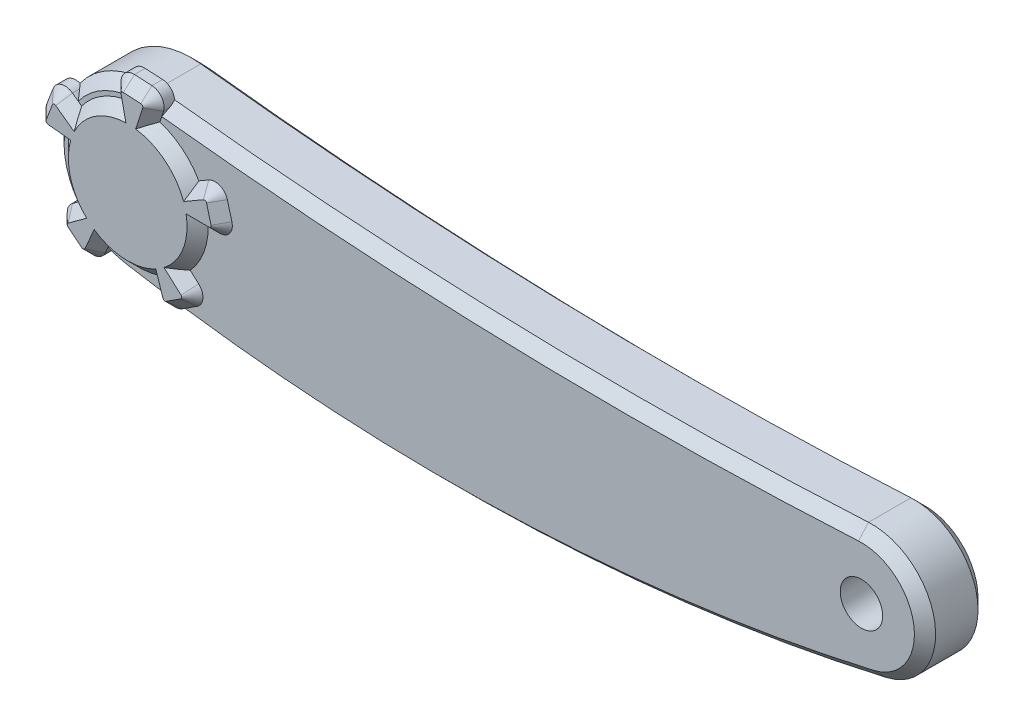
from build123d import *

# Parameters (mm, degrees)
BOSS_EXTRUDE2_DEPTH = 7.5
CHAMFER1_SIZE       = 2.5
SKETCH4_R           = 16.5
BOSS_EXTRUDE3_DEPTH = 2.5
BOSS_EXTRUDE4_DEPTH = 5
CHAMFER2_SIZE       = 2.5
SKETCH6_R           = 5
CUT_EXTRUDE1_DEPTH  = 10
SKETCH7_R           = 5
BOSS_EXTRUDE5_DEPTH = 10


with BuildPart() as part:
    # Sketch1 → Boss-Extrude2 (new, symmetric)
    with BuildSketch(Plane.XY):
        with BuildLine():
            ThreePointArc((84.460518945, 14.977598104), (0.616073919, 13.910903957), (-83.022979725, 19.872238008))
            ThreePointArc((-83.022979725, 19.872238008), (-105.080474764, 2.818038301), (-88.656802688, -19.712869593))
            ThreePointArc((-88.656802688, -19.712869593), (0.254242747, -25.987416271), (88.657894096, -14.614713664))
            ThreePointArc((88.657894096, -14.614713664), (100.131353297, 2.106516275), (84.460518945, 14.977598104))
        make_face()
    extrude(amount=BOSS_EXTRUDE2_DEPTH, both=True)

    # Chamfer1
    chamfer1_edges = [part.edges().sort_by_distance(p)[0] for p in [
        (100.131353297, 2.106516275, 7.5),
        (0.616073919, 13.910903957, 7.5),
        (-105.080474764, 2.818038301, 7.5),
        (0.254242747, -25.987416271, 7.5),
        (-105.080474764, 2.818038301, -7.5),
        (0.616073919, 13.910903957, -7.5),
        (100.131353297, 2.106516275, -7.5),
        (0.254242747, -25.987416271, -7.5),
    ]]
    chamfer(chamfer1_edges, length=CHAMFER1_SIZE)

    # Sketch4 → Boss-Extrude3 (add, symmetric)
    with BuildSketch(Plane.XY.offset(7.5)):
        with Locations((-85.280003554, 0)):
            Circle(SKETCH4_R)
    extrude(amount=BOSS_EXTRUDE3_DEPTH, both=True)

    # Sketch5 → Boss-Extrude4 (add)
    with BuildSketch(Plane.XY.offset(10)):
        with BuildLine():
            Line((-68.665882393, 9.592167325), (-85.280003554, 0))
            Line((-85.280003554, 0), (-66.095668905, 0))
            ThreePointArc((-66.095668905, 0), (-63.715608884, 1.173715713), (-63.197891426, 3.776457135))
            Line((-63.197891426, 3.776457135), (-64.268104914, 7.770548248))
            ThreePointArc((-64.268104914, 7.770548248), (-66.017832096, 9.765729711), (-68.665882393, 9.592167325))
        make_face()
        with BuildLine():
            Line((-71.023264529, -12.836825476), (-85.280003554, 0))
            Line((-85.280003554, 0), (-79.351718121, -18.245386479))
            ThreePointArc((-79.351718121, -18.245386479), (-77.49996915, -20.146259969), (-74.864631467, -19.834347199))
            Line((-74.864631467, -19.834347199), (-71.396739243, -17.582271657))
            ThreePointArc((-71.396739243, -17.582271657), (-70.039904347, -15.30163724), (-71.023264529, -12.836825476))
        make_face()
        with BuildLine():
            Line((-93.082975429, -17.525761777), (-85.280003554, 0))
            Line((-85.280003554, 0), (-100.800456311, -11.276268982))
            ThreePointArc((-100.800456311, -11.276268982), (-102.036072529, -13.62478912), (-100.925061727, -16.034757849))
            Line((-100.925061727, -16.034757849), (-97.711572975, -18.636989732))
            ThreePointArc((-97.711572975, -18.636989732), (-95.12327571, -19.222661609), (-93.082975429, -17.525761777))
        make_face()
        with BuildLine():
            Line((-104.35924441, 2.00530902), (-85.280003554, 0))
            Line((-85.280003554, 0), (-100.800456311, 11.276268982))
            ThreePointArc((-100.800456311, 11.276268982), (-103.415858102, 11.725677203), (-105.364553347, 9.924321847))
            Line((-105.364553347, 9.924321847), (-106.8464003, 6.063978554))
            ThreePointArc((-106.8464003, 6.063978554), (-106.603579514, 3.421379012), (-104.35924441, 2.00530902))
        make_face()
        with BuildLine():
            Line((-89.268651008, 18.765110909), (-85.280003554, 0))
            Line((-85.280003554, 0), (-79.351718121, 18.245386479))
            ThreePointArc((-79.351718121, 18.245386479), (-79.732509104, 20.871656173), (-82.047879802, 22.168326066))
            Line((-82.047879802, 22.168326066), (-86.177200337, 22.384734585))
            ThreePointArc((-86.177200337, 22.384734585), (-88.615426102, 21.337190126), (-89.268651008, 18.765110909))
        make_face()
    extrude(amount=-BOSS_EXTRUDE4_DEPTH)

    # Chamfer2
    chamfer2_edges = [part.edges().sort_by_distance(p)[0] for p in [
        (-69.828233392, 8.921083662, 10),
        (-66.017832096, 9.765729711, 10),
        (-63.73299817, 5.773502692, 10),
        (-63.715608884, 1.173715713, 10),
        (-67.437836229, 0, 10),
        (-69.875926517, -5.913071167, 10),
        (-72.020689231, -11.938740241, 10),
        (-70.039904347, -15.30163724, 10),
        (-73.130685355, -18.708309428, 10),
        (-77.49996915, -20.146259969, 10),
        (-79.766470634, -16.968909499, 10),
        (-86.143546832, -16.477387323, 10),
        (-92.537066797, -16.299630914, 10),
        (-95.12327571, -19.222661609, 10),
        (-99.318317351, -17.33587379, 10),
        (-102.036072529, -13.62478912, 10),
        (-99.714620136, -10.487362822, 10),
        (-101.217779688, -4.270514244, 10),
        (-103.024429619, 1.865014332, 10),
        (-106.603579514, 3.421379012, 10),
        (-106.105476824, 7.994150201, 10),
        (-103.415858102, 11.725677203, 10),
        (-99.714620136, 10.487362822, 10),
        (-94.266547632, 13.838064371, 10),
        (-88.98959873, 17.45227316, 10),
        (-88.615426102, 21.337190126, 10),
        (-84.112540069, 22.276530326, 10),
        (-79.732509104, 20.871656173, 10),
        (-79.766470634, 16.968909499, 10),
        (-74.896217101, 12.822908364, 10),
    ]]
    chamfer(chamfer2_edges, length=CHAMFER2_SIZE - 0.0001)  # a hair under: the kernel refuses the full size

    # Sketch6 → Cut-Extrude1 (cut)
    with BuildSketch(Plane.XY.offset(7.5)):
        with Locations((85.280003554, 0)):
            Circle(SKETCH6_R)
    extrude(amount=-CUT_EXTRUDE1_DEPTH, mode=Mode.SUBTRACT)

    # Sketch7 → Boss-Extrude5 (add)
    with BuildSketch(Plane(origin=(0, 0, -7.5), x_dir=(-1, 0, 0), z_dir=(0, 0, -1))):
        with Locations((85.280003554, 0)):
            Circle(SKETCH7_R)
    extrude(amount=BOSS_EXTRUDE5_DEPTH)


solid = part.part
